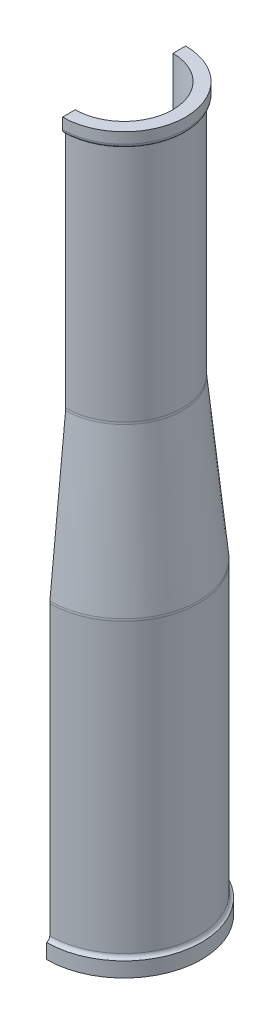
from build123d import *

# Parameters (mm, degrees)
CROQUIS1_R              = 35
SALIENTE_EXTRUIR1_DEPTH = 145
CROQUIS2_R              = 27.5
CROQUIS3_R              = 27.5
SALIENTE_EXTRUIR2_DEPTH = 120
CROQUIS5_R              = 36.5
SALIENTE_EXTRUIR3_DEPTH = 7
CROQUIS4_R              = 23
CORTAR_EXTRUIR1_DEPTH   = 525
REDONDEO1_R             = 10
SALIENTE_EXTRUIR4_START = -7
CROQUIS6_R              = 29
CROQUIS6_R_2            = 23
SALIENTE_EXTRUIR4_DEPTH = 7
REDONDEO2_R             = 2
CROQUIS7_W              = 119.738645001
CROQUIS7_H              = 395.389304841
CORTAR_EXTRUIR2_DEPTH   = 93


with BuildPart() as part:
    # Croquis1 → Saliente-Extruir1 (new body)
    with BuildSketch(Plane(origin=(0, 0, 0), x_dir=(1, 0, 0), z_dir=(0, 1, 0))):
        with Locations(Location((0, 0, 0), (0, 0, 270))):
            Circle(CROQUIS1_R)
    extrude(amount=SALIENTE_EXTRUIR1_DEPTH)

    # Croquis2 → section 1 of recubrir1
    with BuildSketch(Plane(origin=(0, 220, 0), x_dir=(1, 0, 0), z_dir=(0, 1, 0)), mode=Mode.PRIVATE) as recubrir1_s1:
        Circle(CROQUIS2_R)
    # loft up to a face of the part (recubrir1)
    loft([Face(Wire([part.edges().sort_by_distance((25.51390196, 145, -23.959148708))[0]])), recubrir1_s1.sketch])

    # Croquis3 → Saliente-Extruir2 (add)
    with BuildSketch(Plane(origin=(0, 220, 0), x_dir=(1, 0, 0), z_dir=(0, 1, 0))):
        with Locations(Location((0, 0, 0), (0, 0, 270))):
            Circle(CROQUIS3_R)
    extrude(amount=SALIENTE_EXTRUIR2_DEPTH)

    # Croquis5 → Saliente-Extruir3 (add)
    with BuildSketch(Plane.XZ):
        with Locations(Location((0, 0, 0), (0, 0, 270))):
            Circle(CROQUIS5_R)
    extrude(amount=-SALIENTE_EXTRUIR3_DEPTH)

    # Croquis4 → Cortar-Extruir1 (cut)
    with BuildSketch(Plane.XZ):
        with Locations(Location((0, 0, 0), (0, 0, 270))):
            Circle(CROQUIS4_R)
    extrude(amount=-CORTAR_EXTRUIR1_DEPTH, mode=Mode.SUBTRACT)

    # Redondeo1
    # the kernel refuses this fillet: 10 mm, written as the material it adds along each edge
    with BuildSketch(Plane(origin=(0, 220, 0), x_dir=(0, 0, 1), z_dir=(1, 0, 0))) as redondeo1_piece_1:
        with BuildLine():
            CenterArc((27.5 + REDONDEO1_R, -REDONDEO1_R * 0.0498756211209), REDONDEO1_R, 174.289406863, 5.710593137)
            Line((27.5 + REDONDEO1_R * 0.00496280979001, REDONDEO1_R * 0.0496280979001), (27.5, 0))
            Line((27.5, 0), (27.5, -REDONDEO1_R * 0.0498756211209))
        make_face()
    revolve(axis=Axis((0, 220, 0), (0, -1, 0)))
    # the kernel refuses this fillet: 10 mm, written as the material it takes off along each edge
    with BuildSketch(Plane(origin=(0, 145, 0), x_dir=(0, 0, 1), z_dir=(-1, 0, 0))) as redondeo1_2_piece_1:
        with BuildLine():
            CenterArc((35 - REDONDEO1_R, -REDONDEO1_R * 0.0498756211209), REDONDEO1_R, 0, 5.710593137)
            Line((35 - REDONDEO1_R * 0.00496280979001, REDONDEO1_R * 0.0496280979001), (35, 0))
            Line((35, 0), (35, -REDONDEO1_R * 0.0498756211209))
        make_face()
    revolve(axis=Axis((0, 145, 0), (0, 1, 0)), mode=Mode.SUBTRACT)

    # Croquis6 → Saliente-Extruir4 (add)
    with BuildSketch(Plane(origin=(0, 340, 0), x_dir=(1, 0, 0), z_dir=(0, 1, 0)).offset(SALIENTE_EXTRUIR4_START)):
        with Locations(Location((0, 0, 0), (0, 0, 270))):
            Circle(CROQUIS6_R)
        with Locations(Location((0, 0, 0), (0, 0, 90))):
            Circle(CROQUIS6_R_2, mode=Mode.SUBTRACT)
    extrude(amount=SALIENTE_EXTRUIR4_DEPTH)

    # Redondeo2
    # the kernel refuses this fillet: 2 mm, written as the material it adds along each edge
    with BuildSketch(Plane(origin=(0, 7, 0), x_dir=(0, 0, 1), z_dir=(1, 0, 0))) as redondeo2_piece_1:
        with BuildLine():
            CenterArc((37, -1.936491673), REDONDEO2_R, 104.477512186, 75.522487814)
            Line((35, -1.936491673), (34.96, -1.936491673))
            Line((34.96, -1.936491673), (34.96, 0))
            Line((34.96, 0), (35, 0.04))
            ThreePointArc((35, 0.04), (35.75, 0.04), (36.49, 0.038729833))
            Line((36.49, 0.038729833), (36.5, 0))
        make_face()
    revolve(axis=Axis((0, 7, 0), (0, -1, 0)))
    # the kernel refuses this fillet: 2 mm, written as the material it takes off along each edge
    with BuildSketch(Plane(origin=(0, 333, 0), x_dir=(0, 0, 1), z_dir=(-1, 0, 0))) as redondeo2_2_piece_1:
        with BuildLine():
            CenterArc((27, 1.936491673), REDONDEO2_R, 284.477512186, 75.522487814)
            Line((29, 1.936491673), (29.04, 1.936491673))
            Line((29.04, 1.936491673), (29.04, 0))
            Line((29.04, 0), (29, -0.04))
            ThreePointArc((29, -0.04), (28.25, -0.04), (27.51, -0.038729833))
            Line((27.51, -0.038729833), (27.5, 0))
        make_face()
    revolve(axis=Axis((0, 333, 0), (0, 1, 0)), mode=Mode.SUBTRACT)

    # Croquis7 → Cortar-Extruir2 (cut)
    with BuildSketch(Plane(origin=(0, 0, 0), x_dir=(0, 0, -1), z_dir=(1, 0, 0))):
        with Locations((-9.607607261, 197.694652421)):
            Rectangle(CROQUIS7_W, CROQUIS7_H)
    extrude(amount=-CORTAR_EXTRUIR2_DEPTH, mode=Mode.SUBTRACT)


solid = part.part
